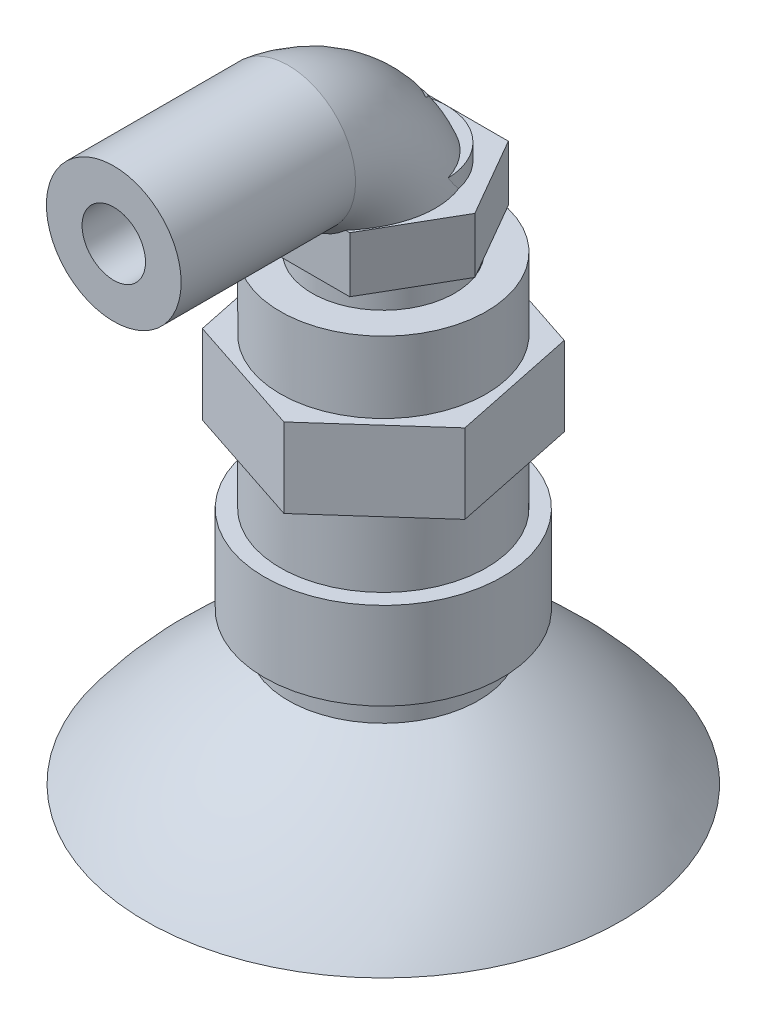
from build123d import *

# Parameters (mm, degrees)
BOSS_EXTRUDE1_DEPTH      = 3.5
BOSS_EXTRUDE2_START      = 1
SKETCH3_R                = 4
BOSS_EXTRUDE2_DEPTH      = 1
BOSS_EXTRUDE3_START      = 6
SKETCH4_R                = 4.25
SKETCH4_R_2              = 2
BOSS_EXTRUDE3_DEPTH      = 11
SKETCH7_R                = 4.25
SKETCH7_R_2              = 2
SKETCH8_R                = 2
CUT_EXTRUDE1_DEPTH       = 31
BOSS_EXTRUDE4_DEPTH      = 2.5
BOSS_EXTRUDE4_DEPTH_BACK = 2.5


with BuildPart() as part:
    # Sketch1 → Revolve1 (revolve)
    with BuildSketch(Plane.XY):
        with BuildLine():
            Line((6, 7.546818264), (6, 8.546818264))
            Line((6, 8.546818264), (5, 8.546818264))
            Line((5, 8.546818264), (5, 9.546818264))
            Line((5, 9.546818264), (7.5, 9.546818264))
            Line((7.5, 9.546818264), (7.5, 15.046818264))
            Line((7.5, 15.046818264), (6.5, 15.046818264))
            Line((6.5, 15.046818264), (6.5, 29.046818264))
            Line((6.5, 29.046818264), (4.5, 29.046818264))
            Line((4.5, 29.046818264), (4.5, 30.546818264))
            Line((4.5, 30.546818264), (0, 30.546818264))
            Line((0, 30.546818264), (0, 7))
            Line((0, 7), (4, 7))
            Line((4, 7), (4, 7.1))
            Line((4, 7.1), (5.574884663, 7.1))
            Line((5.574884663, 7.1), (5.775604281, 7.1))
            ThreePointArc((5.775604281, 7.1), (10.475097255, 4.03540797), (14.372845457, 0))
            Line((14.372845457, 0), (15, 0))
            ThreePointArc((15, 0), (10.940431404, 4.298648047), (6, 7.546818264))
        make_face()
    revolve(axis=Axis((0, 0, 0), (0, 1, 0)))

    # Sketch2 → Boss-Extrude1 (add)
    with BuildSketch(Plane(origin=(0, 30.546818264, 0), x_dir=(1, 0, 0), z_dir=(0, 1, 0))):
        Polygon((2.886751346, -5), (5.773502692, 0), (2.886751346, 5), (-2.886751346, 5), (-5.773502692, 0), (-2.886751346, -5), align=None)
    extrude(amount=BOSS_EXTRUDE1_DEPTH)

    # Sketch3 → Boss-Extrude2 (add)
    with BuildSketch(Plane(origin=(0, 34.046818264, 0), x_dir=(1, 0, 0), z_dir=(0, 1, 0)).offset(BOSS_EXTRUDE2_START)):
        Circle(SKETCH3_R)
    extrude(amount=-BOSS_EXTRUDE2_DEPTH)



with BuildPart() as body_2:
    # Sketch4 → Boss-Extrude3 (new body)
    with BuildSketch(Plane.XY.offset(BOSS_EXTRUDE3_START)):
        with Locations((0, 38)):
            Circle(SKETCH4_R)
        with Locations((0, 38)):
            Circle(SKETCH4_R_2, mode=Mode.SUBTRACT)
    extrude(amount=BOSS_EXTRUDE3_DEPTH)


with BuildPart() as part_1:
    add(part.part)

    add(body_2.part)  # Sweep1 merges body 2
    # Sweep1: sweep along a path in Sketch5
    with BuildLine(Plane(origin=(0, 0, 0), x_dir=(0, 0, -1), z_dir=(1, 0, 0))) as sweep1_path:
        ThreePointArc((-6, 38), (-1.606041048, 35.065368517), (0, 30.031526111))
    # Sketch7 → Sweep1 (sweep)
    with BuildSketch(Plane(origin=(0, 0, 6), x_dir=(-1, 0, 0), z_dir=(0, 0, -1))):
        with Locations((0, 38)):
            Circle(SKETCH7_R)
        with Locations((0, 38)):
            Circle(SKETCH7_R_2, mode=Mode.SUBTRACT)
    sweep(path=sweep1_path.line)

    # Sketch8 → Cut-Extrude1 (cut)
    with BuildSketch(Plane.XZ.offset(-7)):
        Circle(SKETCH8_R)
    extrude(amount=-CUT_EXTRUDE1_DEPTH, mode=Mode.SUBTRACT)

    # Sketch9 → Boss-Extrude4 (add, two sides: drawn at the far end of the back side and taken through both)
    with BuildSketch(Plane(origin=(0, 22.046818264, 0), x_dir=(1, 0, 0), z_dir=(0, 1, 0)).offset(-BOSS_EXTRUDE4_DEPTH_BACK)):
        Polygon((6.030011165, 5.38259219), (-1.646455993, 7.913438949), (-7.676467157, 2.530846759), (-6.030011165, -5.38259219), (1.646455993, -7.913438949), (7.676467157, -2.530846759), align=None)
    extrude(amount=BOSS_EXTRUDE4_DEPTH + BOSS_EXTRUDE4_DEPTH_BACK)


solid = part_1.part
